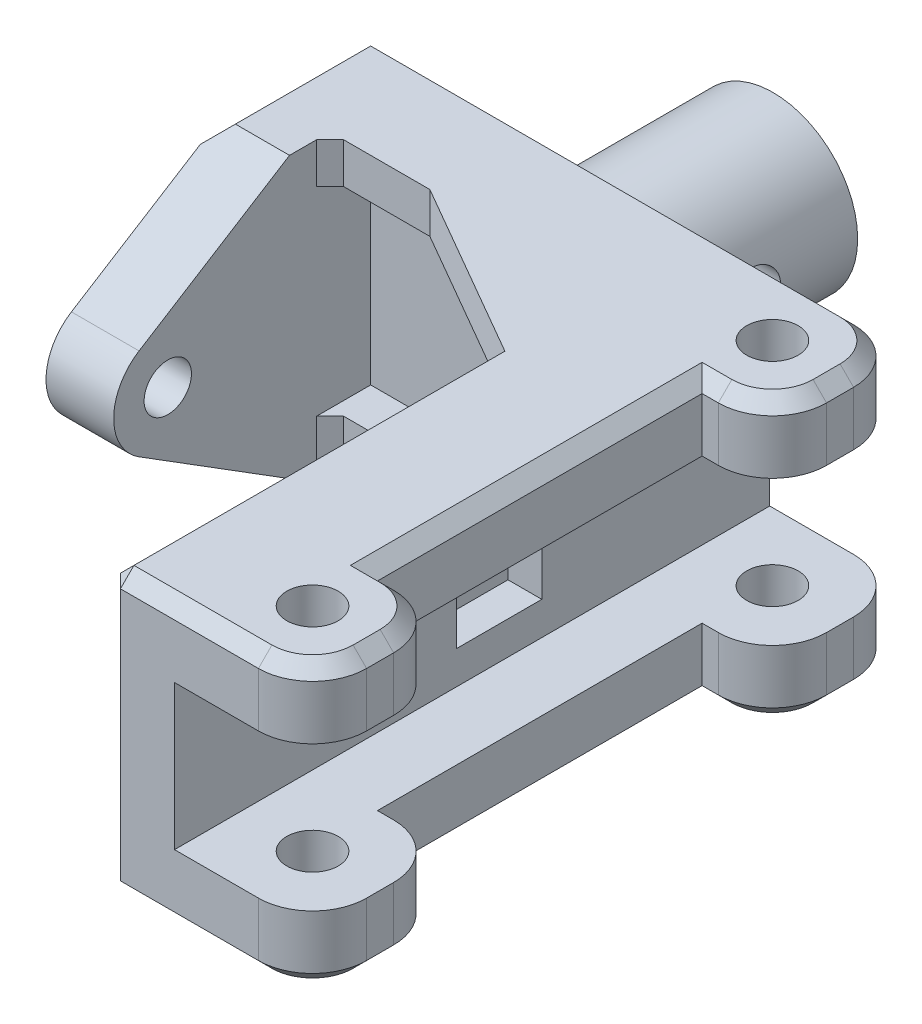
from build123d import *

# Parameters (mm, degrees)
SKETCH_1_R               = 6.25
EXTRUDE_1_DEPTH          = 15
SKETCH_2_W               = 29.5
SKETCH_2_H               = 20.7
EXTRUDE_2_DEPTH          = 5
SKETCH_3_W               = 39
SKETCH_3_H               = 20.7
SKETCH_3_R               = 1.75
EXTRUDE_3_DEPTH          = 5
SKETCH_4_W               = 10
SKETCH_4_H               = 5
EXTRUDE_4_DEPTH          = 10.2
SKETCH_5_R               = 1.9
CUT_EXTRUDE_1_DEPTH      = 55.653385074
FILLET_1_R               = 4
SKETCH_8_W               = 24
SKETCH_8_H               = 5
EXTRUDE_6_DEPTH          = 5
EXTRUDE_START            = -5
SKETCH_9_R               = 1.75
EXTRUDE_7_DEPTH          = 5
EXTRUDE_5_DEPTH          = 3
CHAMFER_1_SIZE           = 1
CHAMFER_2_SIZE           = 1
SKETCH_10_W              = 6.3
SKETCH_10_H              = 5.8
CUT_EXTRUDE_2_DEPTH      = 2.5
CUT_EXTRUDE_3_DEPTH      = 52.62969107
CUT_EXTRUDE_3_DEPTH_BACK = 52.62969107
SKETCH_11_R              = 1.8


with BuildPart() as part:
    # ｽｹｯﾁ1 → ﾎﾞｽ - 押し出し1 (new body)
    with BuildSketch(Plane.XY):
        Circle(SKETCH_1_R)
    extrude(amount=-EXTRUDE_1_DEPTH)

    # ｽｹｯﾁ2 → ﾎﾞｽ - 押し出し2 (add)
    with BuildSketch(Plane.XY):
        Rectangle(SKETCH_2_W, SKETCH_2_H)
    extrude(amount=EXTRUDE_2_DEPTH)

    # ｽｹｯﾁ3 → ﾎﾞｽ - 押し出し3 (add)
    with BuildSketch(Plane(origin=(14.75, 0, 0), x_dir=(0, 0, -1), z_dir=(1, 0, 0))):
        with Locations((-24.5, 0)):
            Rectangle(SKETCH_3_W, SKETCH_3_H)
        with Locations((-20, 0)):
            Circle(SKETCH_3_R, mode=Mode.SUBTRACT)
    extrude(amount=-EXTRUDE_3_DEPTH)

    # ｽｹｯﾁ4 → ﾎﾞｽ - 押し出し4 (add)
    with BuildSketch(Plane(origin=(14.75, 0, 0), x_dir=(0, 0, -1), z_dir=(1, 0, 0))):
        with Locations((-5, 7.85)):
            Rectangle(SKETCH_4_W, SKETCH_4_H)
        with Locations((-5, -7.85)):
            Rectangle(SKETCH_4_W, SKETCH_4_H)
        with Locations((-39, 7.85)):
            Rectangle(SKETCH_4_W, SKETCH_4_H)
        with Locations((-39, -7.85)):
            Rectangle(SKETCH_4_W, SKETCH_4_H)
    extrude(amount=EXTRUDE_4_DEPTH)

    # ｽｹｯﾁ5 → ｶｯﾄ - 押し出し1 (cut, through all)
    with BuildSketch(Plane.XZ.offset(10.35)):
        with Locations((19.95, 5)):
            Circle(SKETCH_5_R)
        with Locations((19.95, 39)):
            Circle(SKETCH_5_R)
    extrude(amount=-CUT_EXTRUDE_1_DEPTH, mode=Mode.SUBTRACT)

    # ﾌｨﾚｯﾄ1
    fillet_1_edges = [part.edges().sort_by_distance(p)[0] for p in [
        (24.95, 7.85, 10),
        (24.95, 7.85, 0),
        (24.95, -7.85, 0),
        (24.95, -7.85, 10),
        (24.95, -7.85, 34),
        (24.95, 7.85, 34),
        (24.95, 7.85, 44),
        (24.95, -7.85, 44),
    ]]
    fillet(fillet_1_edges, radius=FILLET_1_R)

    # ｽｹｯﾁ8 → ﾎﾞｽ - 押し出し6 (add)
    with BuildSketch(Plane(origin=(14.75, 0, 0), x_dir=(0, 0, -1), z_dir=(1, 0, 0))):
        with Locations((-22, 7.85)):
            Rectangle(SKETCH_8_W, SKETCH_8_H)
        with Locations((-22, -7.85)):
            Rectangle(SKETCH_8_W, SKETCH_8_H)
    extrude(amount=EXTRUDE_6_DEPTH)

    # ｽｹｯﾁ9 → ﾎﾞｽ - 押し出し7 (add)
    with BuildSketch(Plane.ZY.offset(14.75).offset(EXTRUDE_START)):
        with BuildLine():
            Line((5, 10.35), (11, 10.35))
            Line((11, 10.35), (22.121751649, 3.390895153))
            ThreePointArc((22.121751649, 3.390895153), (24, 0), (22.121751649, -3.390895153))
            Line((22.121751649, -3.390895153), (11, -10.35))
            Line((11, -10.35), (5, -10.35))
            Line((5, -10.35), (5, 10.35))
        make_face()
        with Locations((20, 0)):
            Circle(SKETCH_9_R, mode=Mode.SUBTRACT)
    extrude(amount=EXTRUDE_7_DEPTH)

    # ｽｹｯﾁ6 → ﾎﾞｽ - 押し出し5 (add)
    with BuildSketch(Plane.XZ.offset(10.35)):
        Polygon((-9.75, 5), (9.75, 5), (9.75, 15), (-2.374355653, 8), (-9.75, 8), align=None)
    extrude_5 = extrude(amount=-EXTRUDE_5_DEPTH)

    # ﾐﾗｰ1: ﾎﾞｽ - 押し出し5 across plane
    add(extrude_5.mirror(Plane.ZX))

    # 面取り1
    chamfer_1_edges = [part.edges().sort_by_distance(p)[0] for p in [
        (19.75, 10.35, 22),
        (20.35, 10.35, 10),
        (23.778427125, 10.35, 8.828427125),
        (24.95, 10.35, 5),
        (23.778427125, 10.35, 1.171572875),
        (3.1, 10.35, 0),
        (-14.75, 10.35, 5.5),
        (-14.75, 0, 0),
        (-14.75, -10.35, 5.5),
        (20.35, -10.35, 10),
        (3.1, -10.35, 0),
        (23.778427125, -10.35, 8.828427125),
        (23.778427125, -10.35, 1.171572875),
        (24.95, -10.35, 5),
        (19.75, -10.35, 22),
        (20.35, 10.35, 34),
        (20.35, -10.35, 34),
        (23.778427125, 10.35, 35.171572875),
        (23.778427125, -10.35, 35.171572875),
        (24.95, 10.35, 39),
        (24.95, -10.35, 39),
        (23.778427125, 10.35, 42.828427125),
        (23.778427125, -10.35, 42.828427125),
        (15.35, 10.35, 44),
        (15.35, -10.35, 44),
        (9.75, 10.35, 29.5),
        (9.75, 0, 44),
        (9.75, -10.35, 29.5),
    ]]
    chamfer(chamfer_1_edges, length=CHAMFER_1_SIZE)

    # 面取り2
    chamfer_2_edges = [part.edges().sort_by_distance(p)[0] for p in [
        (-9.75, 8.85, 8),
        (-9.75, -8.85, 8),
    ]]
    chamfer(chamfer_2_edges, length=CHAMFER_2_SIZE)

    # ｽｹｯﾁ10 → ｶｯﾄ - 押し出し2 (cut)
    with BuildSketch(Plane(origin=(14.75, 0, 0), x_dir=(0, 0, -1), z_dir=(1, 0, 0))):
        with Locations((-20, 0)):
            Rectangle(SKETCH_10_W, SKETCH_10_H)
    extrude(amount=-CUT_EXTRUDE_2_DEPTH, mode=Mode.SUBTRACT)

    # ｽｹｯﾁ11 → ｶｯﾄ - 押し出し3 (cut, two sides: drawn at the far end of the back side and taken through both)
    with BuildSketch(Plane(origin=(0, 0, 0), x_dir=(0, 0, -1), z_dir=(1, 0, 0)).offset(-CUT_EXTRUDE_3_DEPTH_BACK)):
        with Locations((7.5, 0)):
            Circle(SKETCH_11_R)
    extrude(amount=CUT_EXTRUDE_3_DEPTH + CUT_EXTRUDE_3_DEPTH_BACK, mode=Mode.SUBTRACT)


solid = part.part
